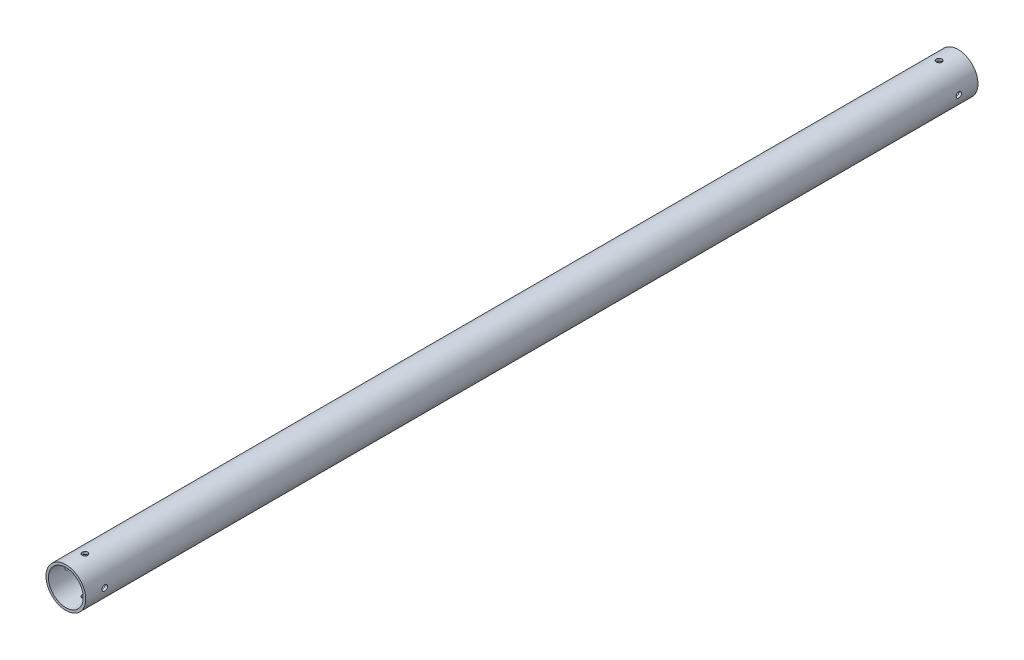
from build123d import *

# Parameters (mm, degrees)
SKETCH2_R               = 12.7
SKETCH2_R_2             = 11.1125
BOSS_EXTRUDE1_DEPTH     = 285.09415041
CUT_EXTRUDE1_DEPTH      = 286.659333119
CUT_EXTRUDE1_DEPTH_BACK = 286.659333119
SKETCH3_R               = 1.7526
CUT_EXTRUDE2_DEPTH      = 286.659333229
CUT_EXTRUDE2_DEPTH_BACK = 286.659333229
SKETCH4_R               = 1.7526


with BuildPart() as part:
    # Sketch2 → Boss-Extrude1 (new, symmetric)
    with BuildSketch(Plane.XY):
        Circle(SKETCH2_R)
        Circle(SKETCH2_R_2, mode=Mode.SUBTRACT)
    extrude(amount=BOSS_EXTRUDE1_DEPTH, both=True)

    # Sketch3 → Cut-Extrude1 (cut, two sides: drawn at the far end of the back side and taken through both)
    with BuildSketch(Plane(origin=(0, 0, 0), x_dir=(1, 0, 0), z_dir=(0, 1, 0)).offset(-CUT_EXTRUDE1_DEPTH_BACK)):
        with Locations((0, -272.90215041)):
            Circle(SKETCH3_R)
        with Locations((0, 272.90215041)):
            Circle(SKETCH3_R)
    extrude(amount=CUT_EXTRUDE1_DEPTH + CUT_EXTRUDE1_DEPTH_BACK, mode=Mode.SUBTRACT)

    # Sketch4 → Cut-Extrude2 (cut, two sides: drawn at the far end of the back side and taken through both)
    with BuildSketch(Plane(origin=(0, 0, 0), x_dir=(0, 0, -1), z_dir=(1, 0, 0)).offset(-CUT_EXTRUDE2_DEPTH_BACK)):
        with Locations((-272.90215041, 0)):
            Circle(SKETCH4_R)
        with Locations((272.90215041, 0)):
            Circle(SKETCH4_R)
    extrude(amount=CUT_EXTRUDE2_DEPTH + CUT_EXTRUDE2_DEPTH_BACK, mode=Mode.SUBTRACT)


solid = part.part
